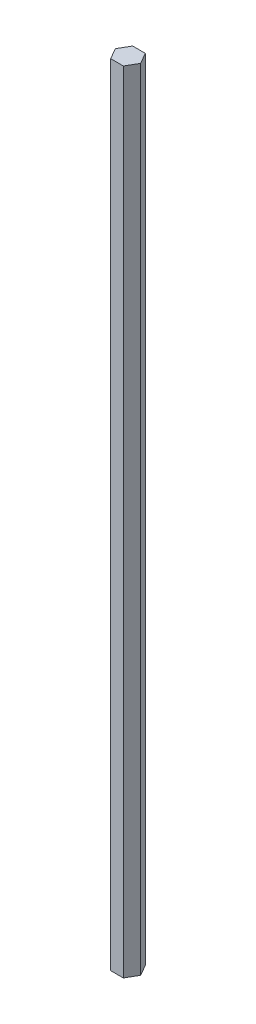
from build123d import *

# Parameters (mm, degrees)
BOSS_EXTRUDE1_DEPTH = 228.6


with BuildPart() as part:
    # Sketch1 → Boss-Extrude1 (new, symmetric)
    with BuildSketch(Plane(origin=(0, 0, 0), x_dir=(1, 0, 0), z_dir=(0, 1, 0))):
        Polygon((7.332348419, 0), (3.666174209, 6.35), (-3.666174209, 6.35), (-7.332348419, 0), (-3.666174209, -6.35), (3.666174209, -6.35), align=None)
    extrude(amount=BOSS_EXTRUDE1_DEPTH, both=True)


solid = part.part
